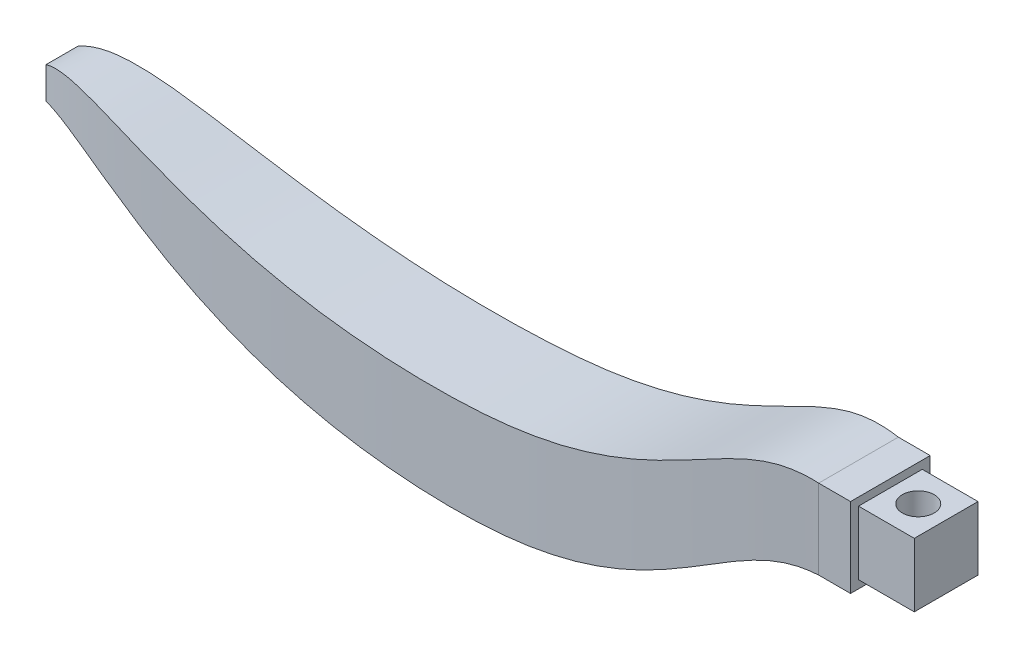
from build123d import *

# Parameters (mm, degrees)
LISSAGE3_START          = -3.052251538
LISSAGE3_DEPTH          = 6.104503076
LISSAGE3_START_2        = -8
LISSAGE3_2_DEPTH        = 14
ESQUISSE6_W             = 5
ESQUISSE6_H             = 5
BOSS_EXTRU_1_DEPTH      = 2
ESQUISSE7_W             = 4
ESQUISSE7_H             = 4
BOSS_EXTRU_2_DEPTH      = 3.5
ESQUISSE8_R             = 1
ENL_V_MAT_EXTRU_1_DEPTH = 10


with BuildPart() as part:
    # Lissage3: read off the stored shape, not the designer's step
    # Lissage3 outline → Lissage3 (new body)
    with BuildSketch(Plane.XY.offset(LISSAGE3_START)):
        with BuildLine():
            Line((50, 0), (50, 5))
            add(Edge.make_bspline(
                [(0, 2), (3.377545484, 3.609985296), (10.5549253, -1.242615205), (26.832856661, -1.404679869), (41.001663162, -0.499032481), (44.589444503, 5.617112925), (50, 5)],
                knots=[0, 0, 0, 0, 0.478857472, 0.532063858, 0.578857472, 1, 1, 1, 1], degree=3))
            Line((0, 2), (0, 0))
            add(Edge.make_bspline(
                [(0, 0), (3.377545484, 0), (10.5549253, -6.641473053), (26.832856661, -7.411609627), (41.001663162, -6.801826433), (44.589444503, 0), (50, 0)],
                knots=[0, 0, 0, 0, 0.478857472, 0.532063858, 0.578857472, 1, 1, 1, 1], degree=3))
        make_face()
    extrude(amount=LISSAGE3_DEPTH)

    # Lissage3 2 outline → Lissage3 2 (cut)
    with BuildSketch(Plane(origin=(0, 0, 0), x_dir=(1.0, 1.8993787323431763e-12, 0), z_dir=(-1.8993787323431763e-12, 1.0, 0)).offset(LISSAGE3_START_2)):
        with BuildLine():
            add(Edge.make_bspline(
                [(0, -1), (3.377545484, -1.804992648), (10.5549253, -2.699428924), (26.832856661, -3.003464879), (30.755103674, -3.044415839), (32.884883561, -3.052251438), (33.849579387, -3.052251438)],
                knots=[0, 0, 0, 0, 0.478857472, 0.532063858, 0.578857472, 0.623121544, 0.623121544, 0.623121544, 0.623121544], degree=3))
            Line((0, -1), (0, -3.052251538))
            Line((0, -3.052251538), (33.849579387, -3.052251438))
        make_face()
        with BuildLine():
            add(Edge.make_bspline(
                [(33.849579387, -3.052251438), (42.063307941, -3.052251437), (45.158119484, -2.776125718), (50, -2.5)],
                knots=[0.623121544, 0.623121544, 0.623121544, 0.623121544, 1, 1, 1, 1], degree=3))
            Line((33.849579387, -3.052251438), (50, -3.052251538))
            Line((50, -3.052251538), (50, -2.5))
        make_face()
        with BuildLine():
            Line((0, 3.052251538), (0, 1))
            add(Edge.make_bspline(
                [(0, 1), (3.377545484, 1.804992648), (10.5549253, 2.699428924), (26.832856661, 3.003464879), (30.755103686, 3.044415839), (32.884883582, 3.052251438), (33.849579416, 3.052251438)],
                knots=[0, 0, 0, 0, 0.478857472, 0.532063858, 0.578857472, 0.623121545, 0.623121545, 0.623121545, 0.623121545], degree=3))
            Line((33.849579416, 3.052251438), (0, 3.052251538))
        make_face()
        with BuildLine():
            Line((50, 3.052251538), (33.849579416, 3.052251438))
            add(Edge.make_bspline(
                [(33.849579416, 3.052251438), (42.063307948, 3.052251436), (45.158119489, 2.776125718), (50, 2.5)],
                knots=[0.623121545, 0.623121545, 0.623121545, 0.623121545, 1, 1, 1, 1], degree=3))
            Line((50, 2.5), (50, 3.052251538))
        make_face()
    extrude(amount=LISSAGE3_2_DEPTH, mode=Mode.SUBTRACT)

    # Esquisse6 → Boss.-Extru.1 (add)
    with BuildSketch(Plane(origin=(50, 0, 0), x_dir=(0, 0, -1), z_dir=(1, 0, 0))):
        with Locations((0, 2.5)):
            Rectangle(ESQUISSE6_W, ESQUISSE6_H)
    extrude(amount=BOSS_EXTRU_1_DEPTH)

    # Esquisse7 → Boss.-Extru.2 (add)
    with BuildSketch(Plane(origin=(52, 0, 0), x_dir=(0, 0, -1), z_dir=(1, 0, 0))):
        with Locations((0, 2.5)):
            Rectangle(ESQUISSE7_W, ESQUISSE7_H)
    extrude(amount=BOSS_EXTRU_2_DEPTH)

    # Esquisse8 → Enlèv. mat.-Extru.1 (cut)
    with BuildSketch(Plane.XZ.offset(-0.5)):
        with Locations((53.75, 0)):
            Circle(ESQUISSE8_R)
    extrude(amount=-ENL_V_MAT_EXTRU_1_DEPTH, mode=Mode.SUBTRACT)


solid = part.part
